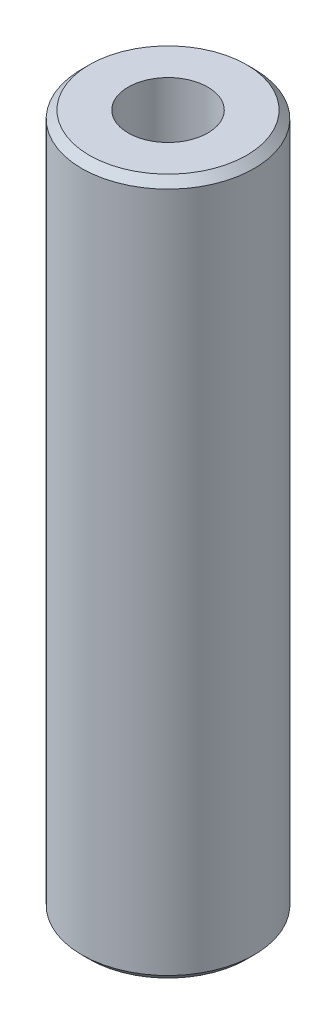
from build123d import *

# Parameters (mm, degrees)
SKETCH1_R           = 15
BOSS_EXTRUDE1_DEPTH = 121.198954946
SKETCH2_R           = 6.929668581
CUT_EXTRUDE1_DEPTH  = 124.0414023
CHAMFER1_SIZE       = 1.322894178


with BuildPart() as part:
    # Sketch1 → Boss-Extrude1 (new body)
    with BuildSketch(Plane(origin=(0, 0, 0), x_dir=(1, 0, 0), z_dir=(0, 1, 0))):
        Circle(SKETCH1_R)
    extrude(amount=BOSS_EXTRUDE1_DEPTH)

    # Sketch2 → Cut-Extrude1 (cut, through all)
    with BuildSketch(Plane(origin=(0, 0, 0), x_dir=(1, 0, 0), z_dir=(0, 1, 0))):
        Circle(SKETCH2_R)
    extrude(amount=CUT_EXTRUDE1_DEPTH, mode=Mode.SUBTRACT)

    # Chamfer1
    chamfer1_edges = [part.edges().sort_by_distance(p)[0] for p in [
        (-15, 121.198954946, 0),
        (-15, 0, 0),
    ]]
    chamfer(chamfer1_edges, length=CHAMFER1_SIZE)


solid = part.part
